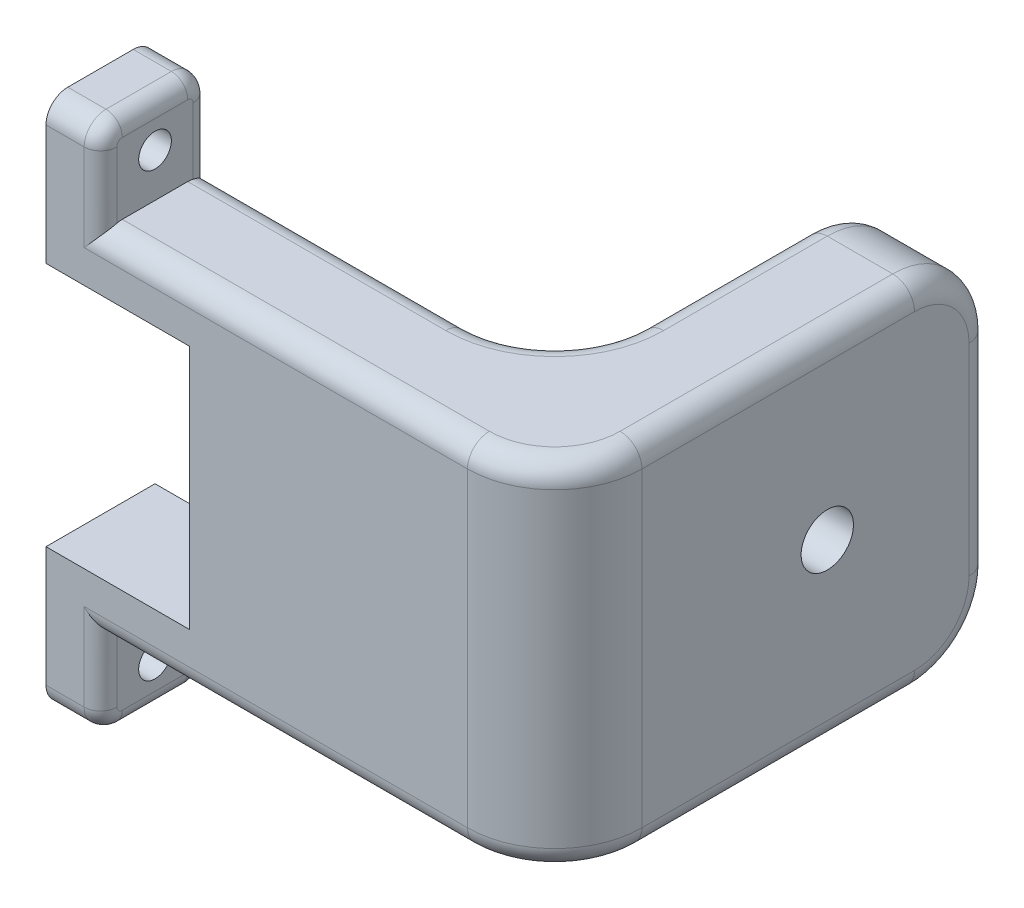
from build123d import *

# Parameters (mm, degrees)
BOSS_EXTRUDE1_DEPTH = 15
SKETCH2_W           = 15
SKETCH2_H           = 32.5
BOSS_EXTRUDE2_DEPTH = 30
SKETCH3_W           = 10
SKETCH3_H           = 32.5
BOSS_EXTRUDE3_DEPTH = 30
SKETCH4_R           = 2.4
CUT_EXTRUDE1_DEPTH  = 5
CUT_EXTRUDE2_DEPTH  = 5
FILLET1_R           = 7
FILLET2_R           = 8
BOSS_EXTRUDE4_DEPTH = 5
SKETCH7_R           = 1.5
CUT_EXTRUDE3_DEPTH  = 59.439112556
FILLET3_R           = 2
FILLET4_R           = 1.5


with BuildPart() as part:
    # Sketch1 → Boss-Extrude1 (new body)
    with BuildSketch(Plane.XY):
        Polygon((-7.003618791, -14.915819089), (6.175, -14.915819089), (6.175, 7.584180911), (-7.003618791, 7.584180911), (-7.003618791, 12.584180911), (9.659757463, 12.584180911), (9.659757463, -19.915819089), (-7.003618791, -19.915819089), align=None)
    extrude(amount=BOSS_EXTRUDE1_DEPTH)

    # Sketch2 → Boss-Extrude2 (add)
    with BuildSketch(Plane(origin=(9.659757463, 0, 0), x_dir=(0, 0, -1), z_dir=(1, 0, 0))):
        with Locations((-7.5, -3.665819089)):
            Rectangle(SKETCH2_W, SKETCH2_H)
    extrude(amount=BOSS_EXTRUDE2_DEPTH)

    # Sketch3 → Boss-Extrude3 (add)
    with BuildSketch(Plane(origin=(0, 0, 0), x_dir=(-1, 0, 0), z_dir=(0, 0, -1))):
        with Locations((-34.659757463, -3.665819089)):
            Rectangle(SKETCH3_W, SKETCH3_H)
    extrude(amount=BOSS_EXTRUDE3_DEPTH)

    # Sketch4 → Cut-Extrude1 (cut)
    with BuildSketch(Plane(origin=(39.659757463, 0, 0), x_dir=(0, 0, -1), z_dir=(1, 0, 0))):
        with Locations((15, -3.53982496)):
            Circle(SKETCH4_R)
    extrude(amount=-CUT_EXTRUDE1_DEPTH, mode=Mode.SUBTRACT)

    # Sketch5 → Cut-Extrude2 (cut)
    with BuildSketch(Plane.XY.offset(15)):
        Polygon((39.659757463, 12.584180911), (-7.003618791, 12.584180911), (-7.003618791, 7.584180911), (6.175, 7.584180911), (6.175, -14.915819089), (-7.003618791, -14.915819089), (-7.003618791, -19.915819089), (39.659757463, -19.915819089), align=None)
    extrude(amount=-CUT_EXTRUDE2_DEPTH, mode=Mode.SUBTRACT)

    # Fillet1
    fillet1_edges = [part.edges().sort_by_distance(p)[0] for p in [
        (34.659757463, 12.584180911, -30),
        (34.659757463, -19.915819089, -30),
    ]]
    fillet(fillet1_edges, radius=FILLET1_R)

    # Fillet2
    fillet2_edges = [part.edges().sort_by_distance(p)[0] for p in [
        (39.659757463, -3.665819089, 10),
        (29.659757463, -3.665819089, 0),
    ]]
    fillet(fillet2_edges, radius=FILLET2_R)

    # Sketch6 → Boss-Extrude4 (add)
    with BuildSketch(Plane.ZY.offset(7.003618791)):
        with BuildLine():
            Line((0, 7.584180911), (10, 7.584180911))
            Line((10, 7.584180911), (10, 18.584180911))
            ThreePointArc((10, 18.584180911), (9.414213562, 19.998394474), (8, 20.584180911))
            Line((8, 20.584180911), (2, 20.584180911))
            ThreePointArc((2, 20.584180911), (0.585786438, 19.998394474), (0, 18.584180911))
            Line((0, 18.584180911), (0, 7.584180911))
        make_face()
        with BuildLine():
            Line((10, -14.915819089), (10, -25.915819089))
            ThreePointArc((10, -25.915819089), (9.414213562, -27.330032651), (8, -27.915819089))
            Line((8, -27.915819089), (2, -27.915819089))
            ThreePointArc((2, -27.915819089), (0.585786438, -27.330032651), (0, -25.915819089))
            Line((0, -25.915819089), (0, -14.915819089))
            Line((0, -14.915819089), (10, -14.915819089))
        make_face()
    extrude(amount=-BOSS_EXTRUDE4_DEPTH)

    # Sketch7 → Cut-Extrude3 (cut, through all)
    with BuildSketch(Plane(origin=(-2.003618791, 0, 0), x_dir=(0, 0, -1), z_dir=(1, 0, 0))):
        with Locations((-5, -23.915819089)):
            Circle(SKETCH7_R)
        with Locations((-5, 16.584180911)):
            Circle(SKETCH7_R)
    extrude(amount=-CUT_EXTRUDE3_DEPTH, mode=Mode.SUBTRACT)

    # Fillet3
    fillet3_edges = [part.edges().sort_by_distance(p)[0] for p in [
        (14.828069336, -19.915819089, 10),
        (37.316611713, -19.915819089, 7.656854249),
        (14.828069336, 12.584180911, 10),
        (37.316611713, 12.584180911, 7.656854249),
        (39.659757463, 12.584180911, -10.5),
        (39.659757463, 10.53392838, -27.949747468),
        (39.659757463, -3.665819089, -30),
        (39.659757463, -17.865566557, -27.949747468),
        (9.828069336, 12.584180911, 0),
        (27.316611713, 12.584180911, -2.343145751),
        (29.659757463, 12.584180911, -15.5),
        (29.659757463, 10.53392838, -27.949747468),
        (29.659757463, -3.665819089, -30),
        (29.659757463, -17.865566557, -27.949747468),
        (9.828069336, -19.915819089, 0),
        (27.316611713, -19.915819089, -2.343145751),
        (39.659757463, -19.915819089, -10.5),
        (29.659757463, -19.915819089, -15.5),
    ]]
    fillet(fillet3_edges, radius=FILLET3_R)

    # Fillet4
    fillet4_edges = [part.edges().sort_by_distance(p)[0] for p in [
        (-2.003618791, 14.584180911, 0),
        (-2.003618791, 19.998394474, 0.585786438),
        (-2.003618791, 20.584180911, 5),
        (-2.003618791, 19.998394474, 9.414213562),
        (-2.003618791, -21.915819089, 0),
        (-2.003618791, -27.330032651, 0.585786438),
        (-2.003618791, -27.915819089, 5),
        (-2.003618791, -21.915819089, 10),
        (-2.003618791, 14.584180911, 10),
        (-2.003618791, -27.330032651, 9.414213562),
    ]]
    fillet(fillet4_edges, radius=FILLET4_R)


solid = part.part
